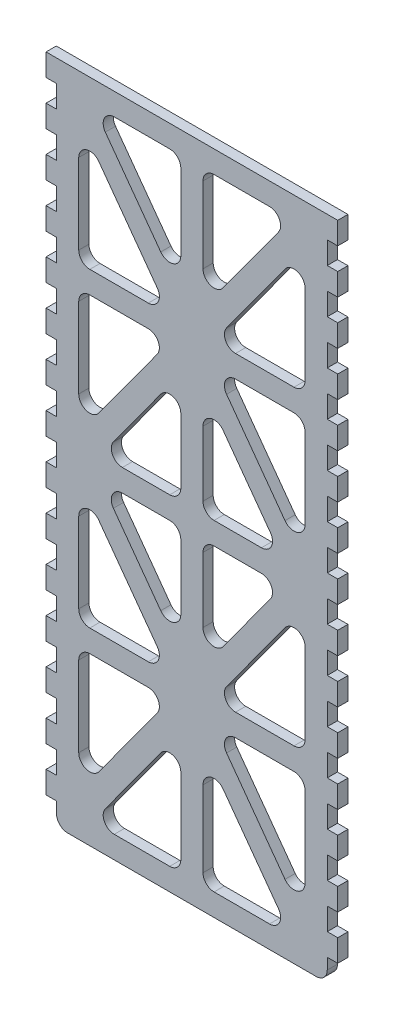
from build123d import *

# Parameters (mm, degrees)
SKETCH1_W                = 77.47
SKETCH1_H                = 190.5
BOSS_EXTRUDE1_DEPTH      = 1.4605
SKETCH2_W                = 2.921
SKETCH2_H                = 6.35
BOSS_EXTRUDE2_DEPTH      = 3
LPATTERN1_COUNT          = 15
LPATTERN1_PITCH          = 12.7
MIRROR1_COPY_1_SKETCH_W  = 2.921
MIRROR1_COPY_1_SKETCH_H  = 6.35
MIRROR1_COPY_1_DEPTH     = 3
MIRROR1_COPY_2_SKETCH_W  = 2.921
MIRROR1_COPY_2_SKETCH_H  = 6.35
MIRROR1_COPY_2_DEPTH     = 3
MIRROR1_COPY_3_SKETCH_W  = 2.921
MIRROR1_COPY_3_SKETCH_H  = 6.35
MIRROR1_COPY_3_DEPTH     = 3
MIRROR1_COPY_4_SKETCH_W  = 2.921
MIRROR1_COPY_4_SKETCH_H  = 6.35
MIRROR1_COPY_4_DEPTH     = 3
MIRROR1_COPY_5_SKETCH_W  = 2.921
MIRROR1_COPY_5_SKETCH_H  = 6.35
MIRROR1_COPY_5_DEPTH     = 3
MIRROR1_COPY_6_SKETCH_W  = 2.921
MIRROR1_COPY_6_SKETCH_H  = 6.35
MIRROR1_COPY_6_DEPTH     = 3
MIRROR1_COPY_7_SKETCH_W  = 2.921
MIRROR1_COPY_7_SKETCH_H  = 6.35
MIRROR1_COPY_7_DEPTH     = 3
MIRROR1_COPY_8_SKETCH_W  = 2.921
MIRROR1_COPY_8_SKETCH_H  = 6.35
MIRROR1_COPY_8_DEPTH     = 3
MIRROR1_COPY_9_SKETCH_W  = 2.921
MIRROR1_COPY_9_SKETCH_H  = 6.35
MIRROR1_COPY_9_DEPTH     = 3
MIRROR1_COPY_10_SKETCH_W = 2.921
MIRROR1_COPY_10_SKETCH_H = 6.35
MIRROR1_COPY_10_DEPTH    = 3
MIRROR1_COPY_11_SKETCH_W = 2.921
MIRROR1_COPY_11_SKETCH_H = 6.35
MIRROR1_COPY_11_DEPTH    = 3
MIRROR1_COPY_12_SKETCH_W = 2.921
MIRROR1_COPY_12_SKETCH_H = 6.35
MIRROR1_COPY_12_DEPTH    = 3
MIRROR1_COPY_13_SKETCH_W = 2.921
MIRROR1_COPY_13_SKETCH_H = 6.35
MIRROR1_COPY_13_DEPTH    = 3
MIRROR1_COPY_14_SKETCH_W = 2.921
MIRROR1_COPY_14_SKETCH_H = 6.35
MIRROR1_COPY_14_DEPTH    = 3
MIRROR1_COPY_15_SKETCH_W = 2.921
MIRROR1_COPY_15_SKETCH_H = 6.35
MIRROR1_COPY_15_DEPTH    = 3
CUT_EXTRUDE1_DEPTH       = 105.033191655
FILLET1_R                = 3.175


with BuildPart() as part:
    # Sketch1 → Boss-Extrude1 (new, symmetric)
    with BuildSketch(Plane.XY):
        Rectangle(SKETCH1_W, SKETCH1_H)
    extrude(amount=BOSS_EXTRUDE1_DEPTH, both=True)

    # Sketch2 → Boss-Extrude2 (add)
    with BuildSketch(Plane(origin=(38.735, 0, 0), x_dir=(0, 0, -1), z_dir=(1, 0, 0))):
        with Locations((0, -85.725)):
            Rectangle(SKETCH2_W, SKETCH2_H)
    boss_extrude2 = extrude(amount=BOSS_EXTRUDE2_DEPTH)

    # LPattern1: Boss-Extrude2 ×15
    with Locations(*[(0, i * LPATTERN1_PITCH, 0) for i in range(1, LPATTERN1_COUNT)]):
        add(boss_extrude2)

    # Mirror1 copy 1 sketch → Mirror1 copy 1 (add)
    with BuildSketch(Plane(origin=(-38.735, 12.7, 0), x_dir=(0, 0, -1), z_dir=(-1, 0, 0))):
        with Locations((0, 85.725)):
            Rectangle(MIRROR1_COPY_1_SKETCH_W, MIRROR1_COPY_1_SKETCH_H)
    extrude(amount=MIRROR1_COPY_1_DEPTH)

    # Mirror1 copy 2 sketch → Mirror1 copy 2 (add)
    with BuildSketch(Plane(origin=(-38.735, 25.4, 0), x_dir=(0, 0, -1), z_dir=(-1, 0, 0))):
        with Locations((0, 85.725)):
            Rectangle(MIRROR1_COPY_2_SKETCH_W, MIRROR1_COPY_2_SKETCH_H)
    extrude(amount=MIRROR1_COPY_2_DEPTH)

    # Mirror1 copy 3 sketch → Mirror1 copy 3 (add)
    with BuildSketch(Plane(origin=(-38.735, 38.1, 0), x_dir=(0, 0, -1), z_dir=(-1, 0, 0))):
        with Locations((0, 85.725)):
            Rectangle(MIRROR1_COPY_3_SKETCH_W, MIRROR1_COPY_3_SKETCH_H)
    extrude(amount=MIRROR1_COPY_3_DEPTH)

    # Mirror1 copy 4 sketch → Mirror1 copy 4 (add)
    with BuildSketch(Plane(origin=(-38.735, 50.8, 0), x_dir=(0, 0, -1), z_dir=(-1, 0, 0))):
        with Locations((0, 85.725)):
            Rectangle(MIRROR1_COPY_4_SKETCH_W, MIRROR1_COPY_4_SKETCH_H)
    extrude(amount=MIRROR1_COPY_4_DEPTH)

    # Mirror1 copy 5 sketch → Mirror1 copy 5 (add)
    with BuildSketch(Plane(origin=(-38.735, 63.5, 0), x_dir=(0, 0, -1), z_dir=(-1, 0, 0))):
        with Locations((0, 85.725)):
            Rectangle(MIRROR1_COPY_5_SKETCH_W, MIRROR1_COPY_5_SKETCH_H)
    extrude(amount=MIRROR1_COPY_5_DEPTH)

    # Mirror1 copy 6 sketch → Mirror1 copy 6 (add)
    with BuildSketch(Plane(origin=(-38.735, 76.2, 0), x_dir=(0, 0, -1), z_dir=(-1, 0, 0))):
        with Locations((0, 85.725)):
            Rectangle(MIRROR1_COPY_6_SKETCH_W, MIRROR1_COPY_6_SKETCH_H)
    extrude(amount=MIRROR1_COPY_6_DEPTH)

    # Mirror1 copy 7 sketch → Mirror1 copy 7 (add)
    with BuildSketch(Plane(origin=(-38.735, 88.9, 0), x_dir=(0, 0, -1), z_dir=(-1, 0, 0))):
        with Locations((0, 85.725)):
            Rectangle(MIRROR1_COPY_7_SKETCH_W, MIRROR1_COPY_7_SKETCH_H)
    extrude(amount=MIRROR1_COPY_7_DEPTH)

    # Mirror1 copy 8 sketch → Mirror1 copy 8 (add)
    with BuildSketch(Plane(origin=(-38.735, 101.6, 0), x_dir=(0, 0, -1), z_dir=(-1, 0, 0))):
        with Locations((0, 85.725)):
            Rectangle(MIRROR1_COPY_8_SKETCH_W, MIRROR1_COPY_8_SKETCH_H)
    extrude(amount=MIRROR1_COPY_8_DEPTH)

    # Mirror1 copy 9 sketch → Mirror1 copy 9 (add)
    with BuildSketch(Plane(origin=(-38.735, 114.3, 0), x_dir=(0, 0, -1), z_dir=(-1, 0, 0))):
        with Locations((0, 85.725)):
            Rectangle(MIRROR1_COPY_9_SKETCH_W, MIRROR1_COPY_9_SKETCH_H)
    extrude(amount=MIRROR1_COPY_9_DEPTH)

    # Mirror1 copy 10 sketch → Mirror1 copy 10 (add)
    with BuildSketch(Plane(origin=(-38.735, 127, 0), x_dir=(0, 0, -1), z_dir=(-1, 0, 0))):
        with Locations((0, 85.725)):
            Rectangle(MIRROR1_COPY_10_SKETCH_W, MIRROR1_COPY_10_SKETCH_H)
    extrude(amount=MIRROR1_COPY_10_DEPTH)

    # Mirror1 copy 11 sketch → Mirror1 copy 11 (add)
    with BuildSketch(Plane(origin=(-38.735, 139.7, 0), x_dir=(0, 0, -1), z_dir=(-1, 0, 0))):
        with Locations((0, 85.725)):
            Rectangle(MIRROR1_COPY_11_SKETCH_W, MIRROR1_COPY_11_SKETCH_H)
    extrude(amount=MIRROR1_COPY_11_DEPTH)

    # Mirror1 copy 12 sketch → Mirror1 copy 12 (add)
    with BuildSketch(Plane(origin=(-38.735, 152.4, 0), x_dir=(0, 0, -1), z_dir=(-1, 0, 0))):
        with Locations((0, 85.725)):
            Rectangle(MIRROR1_COPY_12_SKETCH_W, MIRROR1_COPY_12_SKETCH_H)
    extrude(amount=MIRROR1_COPY_12_DEPTH)

    # Mirror1 copy 13 sketch → Mirror1 copy 13 (add)
    with BuildSketch(Plane(origin=(-38.735, 165.1, 0), x_dir=(0, 0, -1), z_dir=(-1, 0, 0))):
        with Locations((0, 85.725)):
            Rectangle(MIRROR1_COPY_13_SKETCH_W, MIRROR1_COPY_13_SKETCH_H)
    extrude(amount=MIRROR1_COPY_13_DEPTH)

    # Mirror1 copy 14 sketch → Mirror1 copy 14 (add)
    with BuildSketch(Plane(origin=(-38.735, 177.8, 0), x_dir=(0, 0, -1), z_dir=(-1, 0, 0))):
        with Locations((0, 85.725)):
            Rectangle(MIRROR1_COPY_14_SKETCH_W, MIRROR1_COPY_14_SKETCH_H)
    extrude(amount=MIRROR1_COPY_14_DEPTH)

    # Mirror1 copy 15 sketch → Mirror1 copy 15 (add)
    with BuildSketch(Plane(origin=(-38.735, 0, 0), x_dir=(0, 0, -1), z_dir=(-1, 0, 0))):
        with Locations((0, 85.725)):
            Rectangle(MIRROR1_COPY_15_SKETCH_W, MIRROR1_COPY_15_SKETCH_H)
    extrude(amount=MIRROR1_COPY_15_DEPTH)

    # Sketch4 → Cut-Extrude1 (cut, through all)
    with BuildSketch(Plane.XY.offset(1.4605)):
        Polygon((-26.143480058, 3.175), (-3.175, 3.175), (-3.175, 34.700364785), align=None)
        Polygon((-3.175, -34.700364785), (-3.175, -3.175), (-26.143480058, -3.175), align=None)
        Polygon((3.175, 34.700364785), (3.175, 3.175), (26.143480058, 3.175), align=None)
        Polygon((26.143480058, -3.175), (3.175, -3.175), (3.175, -34.700364785), align=None)
        Polygon((-6.241519942, -41.275), (-32.385, -5.391792078), (-32.385, -41.275), align=None)
        Polygon((-32.385, 41.275), (-32.385, 5.391792078), (-6.241519942, 41.275), align=None)
        Polygon((32.385, -41.275), (32.385, -5.391792078), (6.241519942, -41.275), align=None)
        Polygon((6.241519942, 41.275), (32.385, 5.391792078), (32.385, 41.275), align=None)
        Polygon((-6.241519942, -47.625), (-32.385, -47.625), (-32.385, -83.508207922), align=None)
        Polygon((-32.385, 83.508207922), (-32.385, 47.625), (-6.241519942, 47.625), align=None)
        Polygon((32.385, 83.508207922), (6.241519942, 47.625), (32.385, 47.625), align=None)
        Polygon((-28.456694343, 88.9), (-3.175, 54.199635215), (-3.175, 88.9), align=None)
        Polygon((3.175, 88.9), (3.175, 54.199635215), (28.456694343, 88.9), align=None)
        Polygon((-3.175, -88.9), (-3.175, -54.199635215), (-28.456694343, -88.9), align=None)
        Polygon((28.456694343, -88.9), (3.175, -54.199635215), (3.175, -88.9), align=None)
        Polygon((32.385, -47.625), (6.241519942, -47.625), (32.385, -83.508207922), align=None)
    extrude(amount=-CUT_EXTRUDE1_DEPTH, mode=Mode.SUBTRACT)

    # Fillet1
    fillet1_edges = [part.edges().sort_by_distance(p)[0] for p in [
        (38.735, -95.25, 0),
        (-38.735, -95.25, 0),
        (26.143480058, 3.175, 0),
        (3.175, 3.175, 0),
        (3.175, 34.700364785, 0),
        (-6.241519942, 41.275, 0),
        (-32.385, 5.391792078, 0),
        (-32.385, 41.275, 0),
        (-3.175, 54.199635215, 0),
        (-28.456694343, 88.9, 0),
        (-3.175, 88.9, 0),
        (32.385, 41.275, 0),
        (32.385, 5.391792078, 0),
        (6.241519942, 41.275, 0),
        (26.143480058, -3.175, 0),
        (3.175, -34.700364785, 0),
        (3.175, -3.175, 0),
        (-32.385, -83.508207922, 0),
        (-32.385, -47.625, 0),
        (-6.241519942, -47.625, 0),
        (-32.385, -41.275, 0),
        (-32.385, -5.391792078, 0),
        (-6.241519942, -41.275, 0),
        (-6.241519942, 47.625, 0),
        (-32.385, 47.625, 0),
        (-32.385, 83.508207922, 0),
        (-3.175, -88.9, 0),
        (-28.456694343, -88.9, 0),
        (-3.175, -54.199635215, 0),
        (6.241519942, -47.625, 0),
        (32.385, -47.625, 0),
        (28.456694343, -88.9, 0),
        (3.175, -88.9, 0),
        (3.175, -54.199635215, 0),
        (6.241519942, -41.275, 0),
        (32.385, -5.391792078, 0),
        (32.385, -41.275, 0),
        (32.385, 47.625, 0),
        (6.241519942, 47.625, 0),
        (32.385, 83.508207922, 0),
        (3.175, 54.199635215, 0),
        (3.175, 88.9, 0),
        (28.456694343, 88.9, 0),
        (-3.175, -3.175, 0),
        (-3.175, -34.700364785, 0),
        (-26.143480058, -3.175, 0),
        (-3.175, 3.175, 0),
        (-26.143480058, 3.175, 0),
        (-3.175, 34.700364785, 0),
        (32.385, -83.508207922, 0),
    ]]
    fillet(fillet1_edges, radius=FILLET1_R)


solid = part.part
